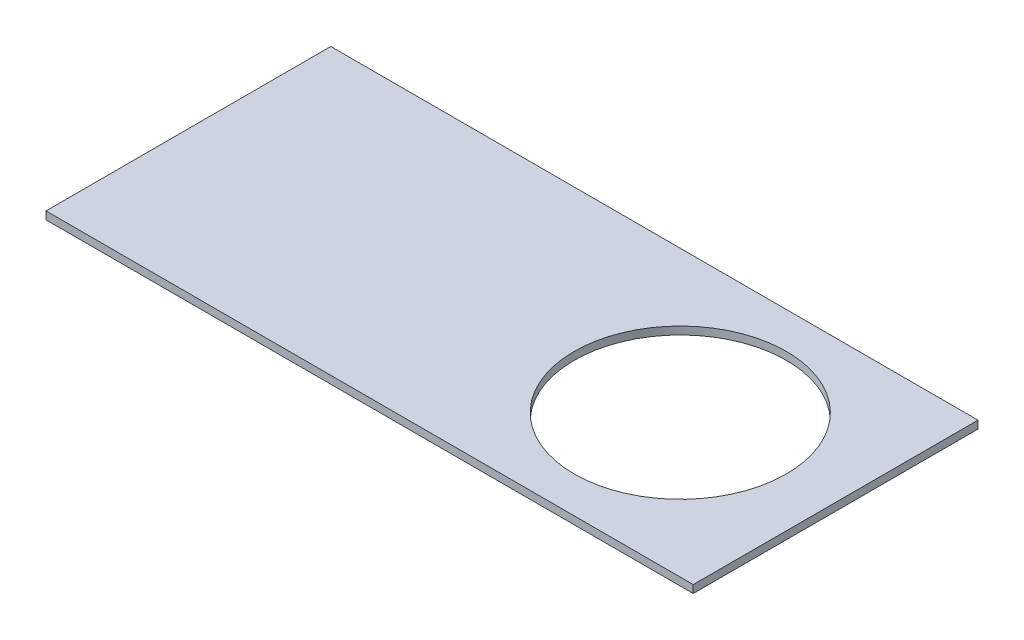
from build123d import *

# Parameters (mm, degrees)
SKETCH_1_W      = 250
SKETCH_1_H      = 110
SKETCH_1_R      = 41
EXTRUDE_1_DEPTH = 3


with BuildPart() as part:
    # Эскиз1 → Бобышка-Вытянуть1 (new body)
    with BuildSketch(Plane(origin=(0, 0, 0), x_dir=(1, 0, 0), z_dir=(0, 1, 0))):
        Rectangle(SKETCH_1_W, SKETCH_1_H)
        with Locations((65, 0)):
            Circle(SKETCH_1_R, mode=Mode.SUBTRACT)
    extrude(amount=EXTRUDE_1_DEPTH)


solid = part.part
